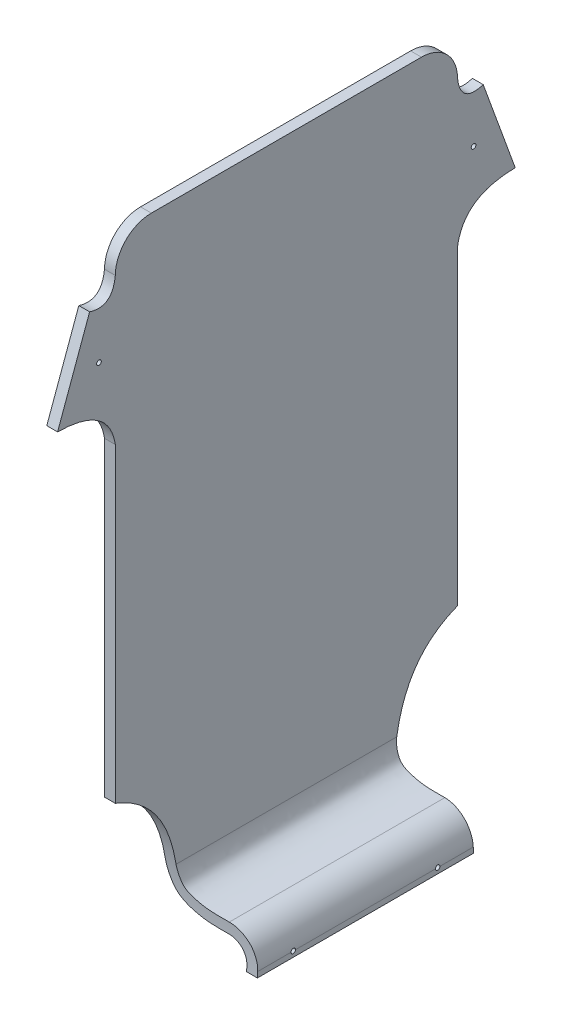
from build123d import *

# Parameters (mm, degrees)
EXTRUDE_THIN1_START     = -120.65
EXTRUDE_THIN1_DEPTH     = 241.3
FILLET1_R               = 25.4
FILLET2_R               = 25.4
CUT_EXTRUDE1_DEPTH      = 470.033978435
CUT_EXTRUDE1_DEPTH_BACK = 470.033978435
CUT_EXTRUDE5_DEPTH      = 15.24
CUT_EXTRUDE5_DEPTH_BACK = 39.37
SKETCH6_R               = 1.5875
BOSS_EXTRUDE1_DEPTH     = 7.62
SKETCH9_R               = 1.651
CUT_EXTRUDE9_DEPTH      = 7.62


# Read off the part's stored shape, not the designer's step: Extrude-Thin1
with BuildPart() as part:
    # Extrude-Thin1 outline → Extrude-Thin1 (new body)
    with BuildSketch(Plane.XY.offset(EXTRUDE_THIN1_START)):
        with BuildLine():
            Line((-48.136484633, 42.398252654), (-48.136484633, 448.798252654))
            Line((-48.136484633, 448.798252654), (-55.756484633, 448.798252654))
            Line((-55.756484633, 448.798252654), (-55.756484633, 42.398252654))
            add(Edge.make_bspline(
                [(-12.565002774, 16.4226331), (-18.660422341, 16.648783951), (-29.593721838, 15.294803784), (-53.049054612, 24.063414555), (-55.748751869, 38.087730663), (-55.756484633, 42.398252654)],
                knots=[0, 0, 0, 0, 0.47979288, 0.674983069, 1, 1, 1, 1], degree=3))
            ThreePointArc((-12.565002774, 16.4226331), (-3.680204107, 12.742428993), (0, 3.857630326))
            Line((0, 3.857630326), (0, 0))
            Line((0, 0), (7.62, 0))
            Line((7.62, 0), (7.62, 3.857630326))
            ThreePointArc((7.62, 3.857630326), (1.761769959, 18.076558557), (-12.412488704, 24.042056908))
            add(Edge.make_bspline(
                [(-12.412488704, 24.042056908), (-14.262208623, 24.106140034), (-16.054759942, 24.078028651), (-19.666309734, 24.046159547), (-21.4850908, 24.039414372), (-25.260641796, 24.188692796), (-27.216781122, 24.343381658), (-30.330916862, 24.801554499), (-31.39895125, 24.992078959), (-33.055395991, 25.349419575), (-33.616606074, 25.480472941), (-34.758646701, 25.769107201), (-35.340221437, 25.926603185), (-37.052406147, 26.429710426), (-38.164623862, 26.811504496), (-40.201493957, 27.664037033), (-41.124128275, 28.13509499), (-42.284444288, 28.872281958), (-42.634290788, 29.122643674), (-43.100505125, 29.498715159), (-43.246220105, 29.624160936), (-43.450579345, 29.811881133), (-43.51636005, 29.874385921), (-43.649067646, 30.004760605), (-43.715258474, 30.071948921), (-44.309224288, 30.694807665), (-44.825849376, 31.382344205), (-45.776124403, 32.973984326), (-46.20816477, 33.875744733), (-46.944137411, 35.767951586), (-47.248356988, 36.757617062), (-47.719156141, 38.676711786), (-47.885935678, 39.606985364), (-48.042550102, 40.82976044), (-48.079286167, 41.208412507), (-48.125975073, 41.878883872), (-48.135737799, 42.17124376), (-48.136484633, 42.398252654)],
                knots=[0, 0, 0, 0, 0.125, 0.125, 0.25, 0.25, 0.375, 0.375, 0.4375, 0.4375, 0.46875, 0.46875, 0.5, 0.5, 0.5625, 0.5625, 0.625, 0.625, 0.65625, 0.65625, 0.671875, 0.671875, 0.6796875, 0.6796875, 0.6875, 0.6875, 0.75, 0.75, 0.8125, 0.8125, 0.875, 0.875, 0.9375, 0.9375, 0.96875, 0.96875, 1, 1, 1, 1], degree=3))
        make_face()
    extrude(amount=EXTRUDE_THIN1_DEPTH)

    # Fillet1
    fillet1_edges = [part.edges().sort_by_distance(p)[0] for p in [
        (-51.946484633, 448.798252654, 120.65),
    ]]
    fillet(fillet1_edges, radius=FILLET1_R)

    # Fillet2
    fillet2_edges = [part.edges().sort_by_distance(p)[0] for p in [
        (-51.946484633, 448.798252654, -120.65),
    ]]
    fillet(fillet2_edges, radius=FILLET2_R)

    # Sketch3 → Cut-Extrude1 (cut, two sides: drawn at the far end of the back side and taken through both)
    with BuildSketch(Plane(origin=(7.62, 0, 0), x_dir=(0, 0, -1), z_dir=(1, 0, 0)).offset(-CUT_EXTRUDE1_DEPTH_BACK)):
        with BuildLine():
            Line((-76.2, 0), (-265.927226228, 0))
            Line((-265.927226228, 0), (-265.927226228, 100.153627915))
            Line((-265.927226228, 100.153627915), (-120.65, 100.991245088))
            add(Edge.make_bspline(
                [(-76.2, 0), (-73.040659179, 57.986016849), (-88.101358348, 88.292728392), (-120.65, 100.991245088)],
                knots=[0, 0, 0, 0, 1, 1, 1, 1], degree=3))
        make_face()
        with BuildLine():
            Line((76.2, 0), (274.249204247, 0))
            Line((274.249204247, 0), (274.249204247, 100.991245088))
            Line((274.249204247, 100.991245088), (120.65, 100.991245088))
            add(Edge.make_bspline(
                [(76.2, 0), (73.040659179, 57.986016849), (88.101358348, 88.292728392), (120.65, 100.991245088)],
                knots=[0, 0, 0, 0, 1, 1, 1, 1], degree=3))
        make_face()
    extrude(amount=CUT_EXTRUDE1_DEPTH + CUT_EXTRUDE1_DEPTH_BACK, mode=Mode.SUBTRACT)

    # Sketch6 → Cut-Extrude5 (cut, two sides: drawn at the far end of the back side and taken through both)
    with BuildSketch(Plane(origin=(7.62, 0, 0), x_dir=(0, 0, -1), z_dir=(1, 0, 0)).offset(-CUT_EXTRUDE5_DEPTH_BACK)):
        with Locations(Location((-50.940117855, 3.857630326, 0), (0, 0, 180))):
            Circle(SKETCH6_R)
        with Locations(Location((50.940117855, 3.857630326, 0), (0, 0, 180))):
            Circle(SKETCH6_R)
    extrude(amount=CUT_EXTRUDE5_DEPTH + CUT_EXTRUDE5_DEPTH_BACK, mode=Mode.SUBTRACT)

    # Sketch8 → Boss-Extrude1 (add)
    with BuildSketch(Plane(origin=(-48.136484633, 0, 0), x_dir=(0, 0, -1), z_dir=(1, 0, 0))):
        with BuildLine():
            Line((-120.65, 423.398252654), (-120.65, 320.10351105))
            add(Edge.make_bspline(
                [(-161.37018803, 348.222464431), (-124.952429667, 347.718299887), (-120.65, 320.10351105)],
                knots=[0, 0, 0, 1, 1, 1], degree=2))
            Line((-161.37018803, 348.222464431), (-138.774399779, 410.276569479))
            add(Edge.make_bspline(
                [(-138.774399779, 410.276569479), (-122.701224636, 405.3331403), (-120.65, 423.398252654)],
                knots=[0, 0, 0, 1, 1, 1], degree=2))
        make_face()
    boss_extrude1 = extrude(amount=-BOSS_EXTRUDE1_DEPTH)

    # Mirror1: Boss-Extrude1 across plane
    add(boss_extrude1.mirror(Plane.XY))

    # Sketch9 → Cut-Extrude9 (cut)
    with BuildSketch(Plane(origin=(-48.136484633, 0, 0), x_dir=(0, 0, -1), z_dir=(1, 0, 0))):
        with Locations((-132.183908419, 375.92)):
            Circle(SKETCH9_R)
        with Locations((131.983751124, 375.92)):
            Circle(SKETCH9_R)
    extrude(amount=-CUT_EXTRUDE9_DEPTH, mode=Mode.SUBTRACT)


solid = part.part
